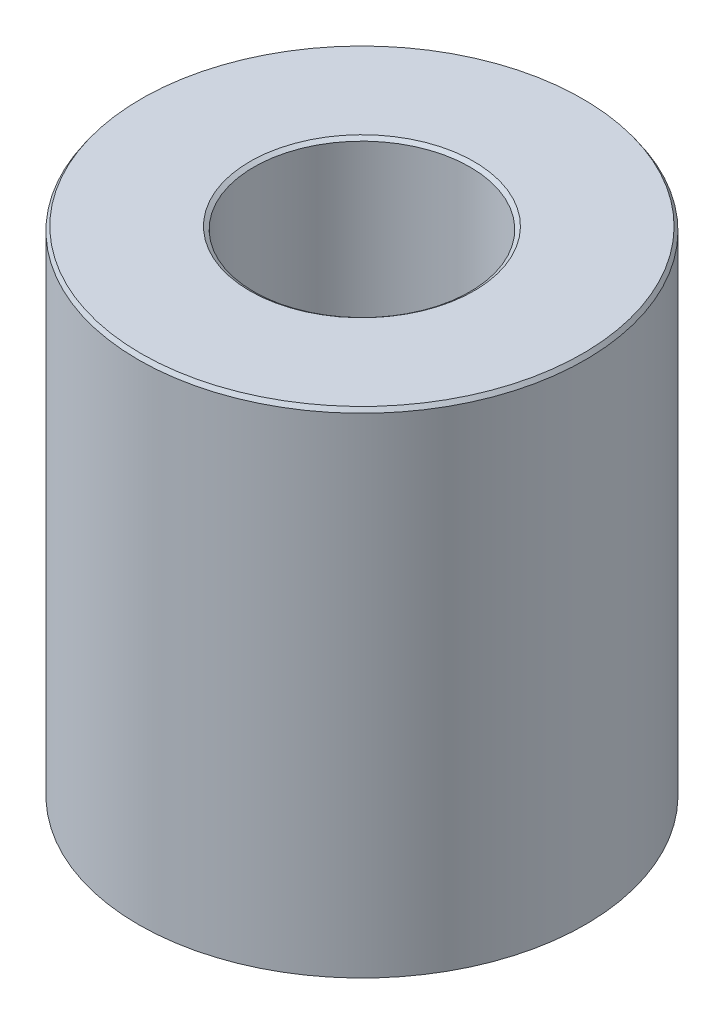
from build123d import *
from OCP.BRepFilletAPI import BRepFilletAPI_MakeChamfer

# Parameters (mm, degrees)
SKETCH1_R           = 50
BOSS_EXTRUDE1_DEPTH = 110.940527978
SKETCH2_R           = 24.183940796
CUT_EXTRUDE1_DEPTH  = 132.559115032
CHAMFER1_SIZE       = 0.894458048
CHAMFER1_SIZE2      = 0.611338029


with BuildPart() as part:
    # Sketch1 → Boss-Extrude1 (new body)
    with BuildSketch(Plane(origin=(0, 0, 0), x_dir=(1, 0, 0), z_dir=(0, 1, 0))):
        Circle(SKETCH1_R)
    extrude(amount=BOSS_EXTRUDE1_DEPTH)

    # Sketch2 → Cut-Extrude1 (cut, through all)
    with BuildSketch(Plane(origin=(0, 0, 0), x_dir=(1, 0, 0), z_dir=(0, 1, 0))):
        Circle(SKETCH2_R)
    extrude(amount=CUT_EXTRUDE1_DEPTH, mode=Mode.SUBTRACT)

    # Chamfer1: one chamfer whose edges measure the first distance from different faces: ONE call of the kernel's chamfer builder (chamfer() names one face for all edges)
    chamfer1_edges_1 = [part.edges().sort_by_distance(p)[0] for p in [
        (-24.183940796, 110.940527978, 0),
    ]]
    chamfer1_side_1 = [part.faces().sort_by_distance(p)[0] for p in [
        (-48.585786438, 110.940527978, 0),
    ]]
    chamfer1_edges_2 = [part.edges().sort_by_distance(p)[0] for p in [
        (-24.183940796, 0, 0),
    ]]
    chamfer1_side_2 = [part.faces().sort_by_distance(p)[0] for p in [
        (-24.183940796, 55.470263989, 0),
    ]]
    chamfer1_edges_3 = [part.edges().sort_by_distance(p)[0] for p in [
        (-50, 0, 0),
    ]]
    chamfer1_side_3 = [part.faces().sort_by_distance(p)[0] for p in [
        (-48.585786438, 0, 0),
    ]]
    chamfer1_edges_4 = [part.edges().sort_by_distance(p)[0] for p in [
        (-50, 110.940527978, 0),
    ]]
    chamfer1_side_4 = [part.faces().sort_by_distance(p)[0] for p in [
        (-50, 55.470263989, 0),
    ]]
    chamfer1 = BRepFilletAPI_MakeChamfer(part.part.solid().wrapped)
    for e in chamfer1_edges_1:
        chamfer1.Add(CHAMFER1_SIZE, CHAMFER1_SIZE2, e.wrapped, chamfer1_side_1[0].wrapped)  # the first distance lies on this face
    for e in chamfer1_edges_2:
        chamfer1.Add(CHAMFER1_SIZE, CHAMFER1_SIZE2, e.wrapped, chamfer1_side_2[0].wrapped)  # the first distance lies on this face
    for e in chamfer1_edges_3:
        chamfer1.Add(CHAMFER1_SIZE, CHAMFER1_SIZE2, e.wrapped, chamfer1_side_3[0].wrapped)  # the first distance lies on this face
    for e in chamfer1_edges_4:
        chamfer1.Add(CHAMFER1_SIZE, CHAMFER1_SIZE2, e.wrapped, chamfer1_side_4[0].wrapped)  # the first distance lies on this face
    add(Compound.cast(chamfer1.Shape()), mode=Mode.REPLACE)


solid = part.part
